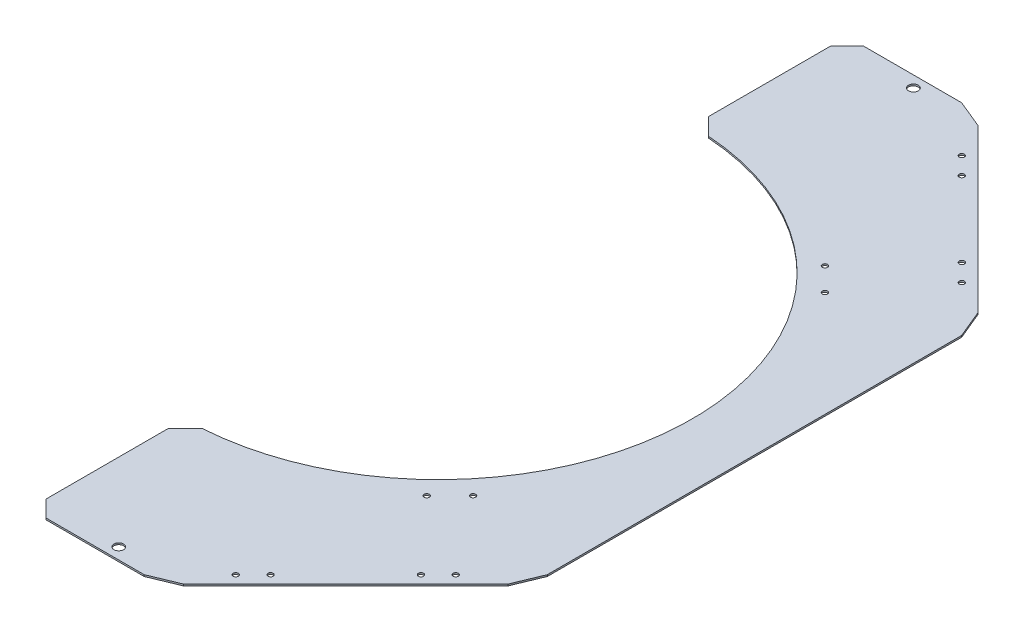
from build123d import *

# Parameters (mm, degrees)
EXTRUDE_1_DEPTH     = 1
SKETCH_4_W          = 56.568542495
SKETCH_4_H          = 273.13708499
CUT_EXTRUDE_3_DEPTH = 354.138500868
CHAMFER_1_SIZE      = 10
SKETCH_5_R          = 1.6
CUT_EXTRUDE_4_DEPTH = 10
SKETCH_6_R          = 3
CUT_EXTRUDE_5_DEPTH = 10
SKETCH_7_R          = 1.6
CUT_EXTRUDE_6_DEPTH = 4


with BuildPart() as part:
    # 草图1 → 凸台-拉伸1 (new body)
    with BuildSketch(Plane(origin=(0, 0, 0), x_dir=(1, 0, 0), z_dir=(0, 1, 0))):
        with BuildLine():
            Line((0, 249.705627485), (0, 155))
            ThreePointArc((0, 155), (109.601551084, 109.601551084), (155, 0))
            ThreePointArc((155, 0), (109.601551084, -109.601551084), (0, -155))
            Line((0, -155), (0, -249.705627485))
            Line((0, -249.705627485), (80, -249.705627485))
            Line((80, -249.705627485), (249.705627485, -80))
            Line((249.705627485, -80), (249.705627485, 0))
            Line((249.705627485, 0), (249.705627485, 80))
            Line((249.705627485, 80), (80, 249.705627485))
            Line((80, 249.705627485), (0, 249.705627485))
        make_face()
    extrude(amount=EXTRUDE_1_DEPTH)

    # 草图4 → 切除-拉伸3 (cut, through all)
    with BuildSketch(Plane(origin=(0, 1, 0), x_dir=(1, 0, 0), z_dir=(0, 1, 0))):
        with Locations((221.421356237, 0)):
            Rectangle(SKETCH_4_W, SKETCH_4_H)
    extrude(amount=-CUT_EXTRUDE_3_DEPTH, mode=Mode.SUBTRACT)

    # 倒角1
    # the kernel refuses this chamfer: 10 mm, written as the material it takes off along each edge
    with BuildSketch(Plane(origin=(0, -26.617651024, -155), x_dir=(0.9994423420060535, 0, 0.0333916906648138), z_dir=(0, 1, 0))) as chamfer_1_piece_1:
        with BuildLine():
            Line((10.351424106, 0), (-CHAMFER_1_SIZE * 0.0333916906648, CHAMFER_1_SIZE * 0.999442342006))
            Line((-CHAMFER_1_SIZE * 0.0333916906648, CHAMFER_1_SIZE * 0.999442342006), (0, 0))
            ThreePointArc((0, 0), (5.321987279, 0.086367968), (10.351424106, 0))
        make_face()
    extrude(amount=54.235302047, mode=Mode.SUBTRACT)
    with BuildSketch(Plane(origin=(0, -25.71682988, -249.705627485), x_dir=(0, 0, 1), z_dir=(0, 1, 0))) as chamfer_1_piece_2:
        Polygon((CHAMFER_1_SIZE, 0), (0, CHAMFER_1_SIZE), (0, 0), align=None)
    extrude(amount=52.433659759, mode=Mode.SUBTRACT)
    with BuildSketch(Plane(origin=(80, -25.926703929, -249.705627485), x_dir=(-1, 0, 0), z_dir=(0, 1, 0)), Plane(origin=(193.13708499, 26.926703929, 136.568542495), x_dir=(-0.7071067811865447, 0, 0.7071067811865503), z_dir=(0, -1, 0))) as chamfer_1_piece_3:
        Polygon((CHAMFER_1_SIZE, 0), (-CHAMFER_1_SIZE * 0.707106781187, CHAMFER_1_SIZE * 0.707106781187), (0, 0), align=None)
    extrude(amount=52.853407858, mode=Mode.SUBTRACT)
    with BuildSketch(Plane(origin=(80, -25.926703929, 249.705627485), x_dir=(-1, 0, 0), z_dir=(0, 1, 0)), Plane(origin=(193.13708499, 26.926703929, -136.568542495), x_dir=(-0.7071067811865476, 0, -0.7071067811865476), z_dir=(0, -1, 0))) as chamfer_1_piece_4:
        Polygon((CHAMFER_1_SIZE, 0), (-CHAMFER_1_SIZE * 0.707106781187, -CHAMFER_1_SIZE * 0.707106781187), (0, 0), align=None)
    extrude(amount=52.853407858, mode=Mode.SUBTRACT)
    with BuildSketch(Plane(origin=(0, -25.71682988, 249.705627485), x_dir=(0, 0, -1), z_dir=(0, 1, 0))) as chamfer_1_piece_5:
        Polygon((CHAMFER_1_SIZE, 0), (0, -CHAMFER_1_SIZE), (0, 0), align=None)
    extrude(amount=52.433659759, mode=Mode.SUBTRACT)
    with BuildSketch(Plane(origin=(0, -26.617651024, 155), x_dir=(0, 0, 1), z_dir=(0, 1, 0))) as chamfer_1_piece_6:
        with BuildLine():
            Line((CHAMFER_1_SIZE, 0), (-0.345651552, 10.345651552))
            ThreePointArc((-0.345651552, 10.345651552), (-0.091390348, 5.321903403), (0, 0))
            Line((0, 0), (CHAMFER_1_SIZE, 0))
        make_face()
    extrude(amount=54.235302047, mode=Mode.SUBTRACT)

    # 草图5 → 切除-拉伸4 (cut)
    with BuildSketch(Plane(origin=(0, 1, 0), x_dir=(1, 0, 0), z_dir=(0, 1, 0))):
        with Locations(Location((98.03122292, -221.774909628, 0), (0, 0, 270))):
            Circle(SKETCH_5_R)
        with Locations(Location((108.637824638, -211.16830791, 0), (0, 0, 270))):
            Circle(SKETCH_5_R)
        with Locations(Location((154.599765415, -165.206367133, 0), (0, 0, 270))):
            Circle(SKETCH_5_R)
        with Locations(Location((165.206367133, -154.599765415, 0), (0, 0, 270))):
            Circle(SKETCH_5_R)
        with Locations(Location((165.206367133, 154.599765415, 0), (0, 0, 270))):
            Circle(SKETCH_5_R)
        with Locations(Location((154.599765415, 165.206367133, 0), (0, 0, 270))):
            Circle(SKETCH_5_R)
        with Locations(Location((108.637824638, 211.16830791, 0), (0, 0, 270))):
            Circle(SKETCH_5_R)
        with Locations(Location((98.03122292, 221.774909628, 0), (0, 0, 270))):
            Circle(SKETCH_5_R)
    extrude(amount=-CUT_EXTRUDE_4_DEPTH, mode=Mode.SUBTRACT)

    # 草图6 → 切除-拉伸5 (cut)
    with BuildSketch(Plane(origin=(0, 1, 0), x_dir=(1, 0, 0), z_dir=(0, 1, 0))):
        with Locations(Location((47.5, 242.75, 0), (0, 0, 270))):
            Circle(SKETCH_6_R)
        with Locations(Location((47.5, -242.75, 0), (0, 0, 270))):
            Circle(SKETCH_6_R)
    extrude(amount=-CUT_EXTRUDE_5_DEPTH, mode=Mode.SUBTRACT)

    # 草图7 → 切除-拉伸6 (cut)
    with BuildSketch(Plane(origin=(0, 1, 0), x_dir=(1, 0, 0), z_dir=(0, 1, 0))):
        with Locations(Location((114.557611845, 121.628679656, 0), (0, 0, 270))):
            Circle(SKETCH_7_R)
        with Locations(Location((128.699747468, 107.486544033, 0), (0, 0, 270))):
            Circle(SKETCH_7_R)
        with Locations(Location((128.699747468, -107.486544033, 0), (0, 0, 270))):
            Circle(SKETCH_7_R)
        with Locations(Location((114.557611845, -121.628679656, 0), (0, 0, 270))):
            Circle(SKETCH_7_R)
    extrude(amount=-CUT_EXTRUDE_6_DEPTH, mode=Mode.SUBTRACT)


solid = part.part
